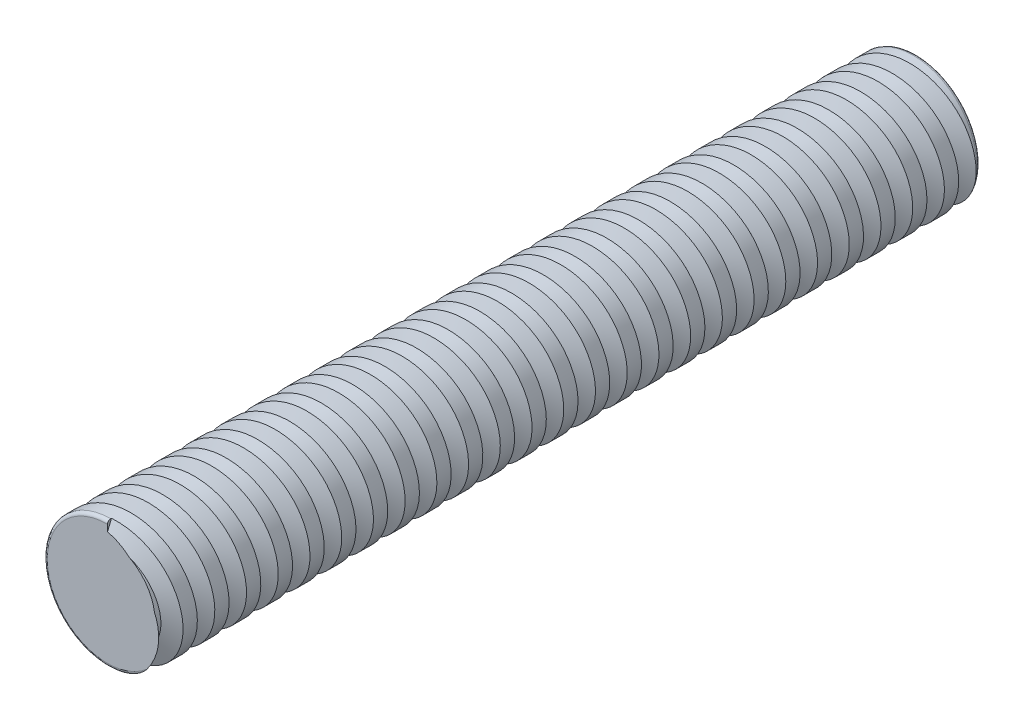
from build123d import *

# Parameters (mm, degrees)
SKETCH1_R           = 4
BOSS_EXTRUDE1_DEPTH = 51
FILLET1_R           = 0.2
CUT_SWEEP1_PITCH    = 2


with BuildPart() as part:
    # Sketch1 → Boss-Extrude1 (new body)
    with BuildSketch(Plane.XY):
        Circle(SKETCH1_R)
    extrude(amount=-BOSS_EXTRUDE1_DEPTH)

    # Fillet1
    fillet1_edges = [part.edges().sort_by_distance(p)[0] for p in [
        (-4, 0, 0),
        (-4, 0, -51),
    ]]
    fillet(fillet1_edges, radius=FILLET1_R)

    # Cut-Sweep1: arcs per turn and ends read off the stored shape
    # Cut-Sweep1: the profile of Sketch3 screwed along a right-hand helix through 100 turns, 6 arcs to a turn; built about Z, then put on its axis
    cut_sweep1_z = Axis((0, 0, 0), (0, 0, 1))
    cut_sweep1_corners = [(3, -2.094e-06, -0.150000222), (3, -2.094e-06, -0.450000222), (5, -3.491e-06, -1.250000222), (5, -3.491e-06, 0.649999778)]
    with BuildLine(mode=Mode.PRIVATE) as cut_sweep1_profile:
        Line(cut_sweep1_corners[0], cut_sweep1_corners[1])
        Line(cut_sweep1_corners[1], cut_sweep1_corners[2])
        Line(cut_sweep1_corners[2], cut_sweep1_corners[3])
        Line(cut_sweep1_corners[3], cut_sweep1_corners[0])
    cut_sweep1_cap = Face(cut_sweep1_profile.wire())
    cut_sweep1_turn_angles = [0, 30, 60, 90, 120, 150, 180, 210, 240, 270, 300, 330, 360]
    cut_sweep1_turn_weights = [1, 0.8660254037844387, 1, 0.8660254037844387, 1, 0.8660254037844387, 1, 0.8660254037844387, 1, 0.8660254037844387, 1, 0.8660254037844387, 1]
    cut_sweep1_turn_rails = [Edge.make_bspline([Vector(p[0], p[1], 0).rotate(cut_sweep1_z, cut_sweep1_turn_angles[k]) / cut_sweep1_turn_weights[k] + Vector(0, 0, p[2] + CUT_SWEEP1_PITCH * cut_sweep1_turn_angles[k] / 360) for k in range(13)], [0, 0, 0, 1, 1, 2, 2, 3, 3, 4, 4, 5, 5, 6, 6, 6], 2, cut_sweep1_turn_weights) for p in cut_sweep1_corners]
    cut_sweep1_turn_sides = [Face.make_surface_from_curves(cut_sweep1_turn_rails[p[0]], cut_sweep1_turn_rails[p[1]]) for p in [(0, 1), (1, 2), (2, 3), (3, 0)]]
    cut_sweep1 = Plane(origin=(0, 0, 0), x_dir=(0, 1, 0), z_dir=(0, 0, -1)) * Solid(Shell([*[p.moved(Location((0, 0, CUT_SWEEP1_PITCH * i))) for i in range(100) for p in cut_sweep1_turn_sides], cut_sweep1_cap, cut_sweep1_cap.rotate(cut_sweep1_z, 36000).moved(Location((0, 0, CUT_SWEEP1_PITCH * 36000 / 360)))]))
    add(cut_sweep1, mode=Mode.SUBTRACT)


solid = part.part
